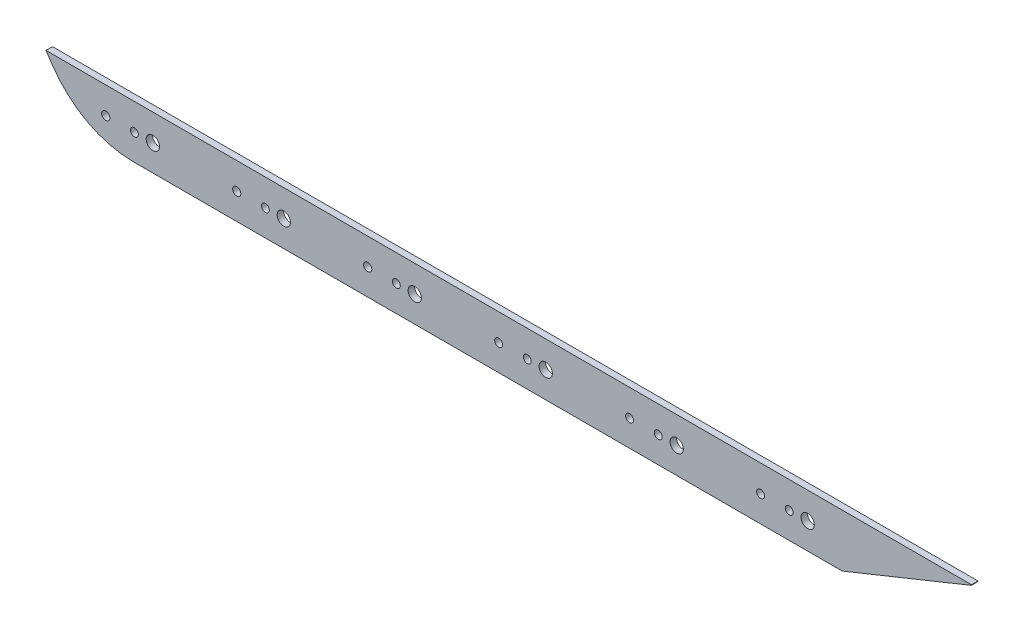
from build123d import *

# Parameters (mm, degrees)
BOSS_EXTRUDE1_DEPTH = 3.175
SKETCH1_4_R         = 3.25
CUT_EXTRUDE1_DEPTH  = 439.905857431
FILLET1_R           = 48
CUT_EXTRUDE3_DEPTH  = 10
CUT_EXTRUDE5_DEPTH  = 10
SKETCH13_R          = 1.925
SKETCH13_R_2        = 2
CUT_EXTRUDE6_DEPTH  = 10


with BuildPart() as part:
    # Sketch1 → Boss-Extrude1 (new body)
    with BuildSketch(Plane.XY):
        Polygon((428.120588235, 28.939617947), (0.540381846, 28.939617947), (-115.605170134, 28.939617947), (-98.879411765, 3.850980392), (-31.879411765, -96.649019608), (366, -96.649019608), (403.120588235, -71.149019608), align=None)
    extrude(amount=BOSS_EXTRUDE1_DEPTH)

    # Sketch1<4> → Cut-Extrude1 (cut, through all)
    with BuildSketch(Plane.XY):
        with Locations((3.120588235, -83.899019608)):
            Circle(SKETCH1_4_R)
        with Locations((67.120588235, -83.899019608)):
            Circle(SKETCH1_4_R)
        with Locations((131.120588235, -83.899019608)):
            Circle(SKETCH1_4_R)
        with Locations((195.120588235, -83.899019608)):
            Circle(SKETCH1_4_R)
        with Locations((259.120588235, -83.899019608)):
            Circle(SKETCH1_4_R)
        with Locations((323.120588235, -83.899019608)):
            Circle(SKETCH1_4_R)
    extrude(amount=CUT_EXTRUDE1_DEPTH, mode=Mode.SUBTRACT)

    # Fillet1
    fillet1_edges = [part.edges().sort_by_distance(p)[0] for p in [
        (-31.879411765, -96.649019608, 1.5875),
    ]]
    fillet(fillet1_edges, radius=FILLET1_R)

    # Sketch7 → Cut-Extrude3 (cut)
    with BuildSketch(Plane.XY.offset(3.175)):
        Polygon((403.120588235, -71.149019608), (340.005873473, -96.649019608), (366, -96.649019608), align=None)
    extrude(amount=-CUT_EXTRUDE3_DEPTH, mode=Mode.SUBTRACT)

    # Sketch11 → Cut-Extrude5 (cut)
    with BuildSketch(Plane.XY.offset(3.175)):
        Polygon((-49.086078431, -70.839019608), (403.198019602, -70.839019608), (428.120588235, 28.939617947), (-115.605170134, 28.939617947), align=None)
    extrude(amount=-CUT_EXTRUDE5_DEPTH, mode=Mode.SUBTRACT)

    # Sketch13 → Cut-Extrude6 (cut)
    with BuildSketch(Plane(origin=(0, 0, 0), x_dir=(-1, 0, 0), z_dir=(0, 0, -1))):
        with Locations((-58.120593324, -83.886258845)):
            Circle(SKETCH13_R)
        with Locations((-44.120593324, -83.886258845)):
            Circle(SKETCH13_R_2)
        with Locations((5.879411765, -83.886258845)):
            Circle(SKETCH13_R)
        with Locations((19.879411765, -83.886258845)):
            Circle(SKETCH13_R_2)
        with Locations((-122.120588235, -83.899019608)):
            Circle(SKETCH13_R)
        with Locations((-108.120588235, -83.899019608)):
            Circle(SKETCH13_R_2)
        with Locations((-186.120588235, -83.899019608)):
            Circle(SKETCH13_R)
        with Locations((-172.120588235, -83.899019608)):
            Circle(SKETCH13_R)
        with Locations((-250.120588235, -83.899019608)):
            Circle(SKETCH13_R)
        with Locations((-236.120588235, -83.899019608)):
            Circle(SKETCH13_R)
        with Locations((-314.120588235, -83.899019608)):
            Circle(SKETCH13_R)
        with Locations((-300.120588235, -83.899019608)):
            Circle(SKETCH13_R)
    extrude(amount=-CUT_EXTRUDE6_DEPTH, mode=Mode.SUBTRACT)


solid = part.part
